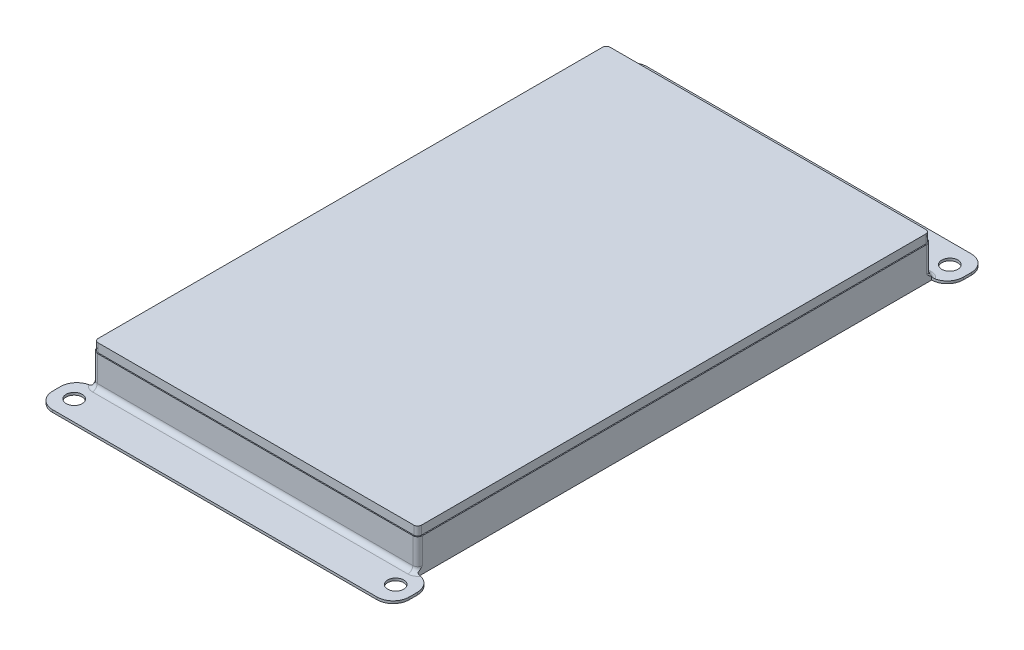
from build123d import *

# Parameters (mm, degrees)
SKETCH_1_R      = 1.65
EXTRUDE_1_DEPTH = 0.5
FILLET_1_R      = 3.3
SKETCH_2_W      = 66.770552446
SKETCH_2_H      = 105.5
EXTRUDE_2_DEPTH = 6.83
FILLET_2_R      = 1
EXTRUDE_3_DEPTH = 1.78
FILLET_3_R      = 1


with BuildPart() as part:
    # 草图1 → 凸台-拉伸1 (new body)
    with BuildSketch(Plane(origin=(0, 0, 0), x_dir=(1, 0, 0), z_dir=(0, 1, 0))):
        Polygon((66.385276223, -4.125), (69.6, -4.125), (69.6, 4.125), (-3.6, 4.125), (-3.6, -4.125), (-0.385276223, -4.125), (-0.385276223, -109.625), (-3.6, -109.625), (-3.6, -117.875), (69.6, -117.875), (69.6, -109.625), (66.385276223, -109.625), align=None)
        with Locations(Location((0, 0, 0), (0, 0, 270))):
            Circle(SKETCH_1_R, mode=Mode.SUBTRACT)
        with Locations(Location((66, 0, 0), (0, 0, 270))):
            Circle(SKETCH_1_R, mode=Mode.SUBTRACT)
        with Locations(Location((66, -113.75, 0), (0, 0, 90))):
            Circle(SKETCH_1_R, mode=Mode.SUBTRACT)
        with Locations(Location((0, -113.75, 0), (0, 0, 90))):
            Circle(SKETCH_1_R, mode=Mode.SUBTRACT)
    extrude(amount=EXTRUDE_1_DEPTH)

    # 圆角1
    # the kernel refuses this fillet: 3.3 mm, written as the material it takes off along each edge
    with BuildSketch(Plane(origin=(69.6, -8.247244982, 109.625), x_dir=(0, 0, 1), z_dir=(0, 1, 0)), Plane(origin=(-3.6, -8.247244982, 4.125), x_dir=(0, 0, -1), z_dir=(0, 1, 0))) as fillet_1_piece_1:
        with BuildLine():
            CenterArc((3.298897993, -3.3), FILLET_1_R, 90, 88.519238897)
            Line((0, -3.214723777), (-0.06597796, -3.213018252))
            ThreePointArc((-0.06597796, -3.213018252), (-0.066, -1.607361888), (-0.066, 0))
            Line((-0.066, 0), (0, 0.066))
            Line((0, 0.066), (3.298897993, 0.066))
            Line((3.298897993, 0.066), (3.298897993, 0))
        make_face()
    extrude(amount=16.994489963, mode=Mode.SUBTRACT)
    with BuildSketch(Plane(origin=(69.6, -8.25, 117.875), x_dir=(-1, 0, 0), z_dir=(0, 1, 0)), Plane(origin=(-3.6, -8.25, 117.875), x_dir=(0, 0, -1), z_dir=(0, 1, 0)), Plane(origin=(-3.6, -8.25, -4.125), x_dir=(1, 0, 0), z_dir=(0, 1, 0)), Plane(origin=(69.6, -8.25, -4.125), x_dir=(0, 0, 1), z_dir=(0, 1, 0))) as fillet_1_piece_2:
        with BuildLine():
            CenterArc((FILLET_1_R, -FILLET_1_R), FILLET_1_R, 90, 90)
            Line((0, -FILLET_1_R), (-FILLET_1_R * 0.02, -FILLET_1_R))
            Line((-FILLET_1_R * 0.02, -FILLET_1_R), (-FILLET_1_R * 0.02, FILLET_1_R * 0.02))
            Line((-FILLET_1_R * 0.02, FILLET_1_R * 0.02), (FILLET_1_R, FILLET_1_R * 0.02))
            Line((FILLET_1_R, FILLET_1_R * 0.02), (FILLET_1_R, 0))
        make_face()
    extrude(amount=17, mode=Mode.SUBTRACT)
    with BuildSketch(Plane(origin=(-3.6, -8.247244982, 109.625), x_dir=(1, 0, 0), z_dir=(0, 1, 0)), Plane(origin=(69.6, -8.247244982, 4.125), x_dir=(-1, 0, 0), z_dir=(0, 1, 0))) as fillet_1_piece_3:
        with BuildLine():
            CenterArc((3.3, -3.298897993), FILLET_1_R, 91.480761103, 88.519238897)
            Line((0, -3.298897993), (-0.066, -3.298897993))
            Line((-0.066, -3.298897993), (-0.066, 0))
            Line((-0.066, 0), (0, 0.066))
            ThreePointArc((0, 0.066), (1.607361888, 0.066), (3.213018252, 0.06597796))
            Line((3.213018252, 0.06597796), (3.214723777, 0))
        make_face()
    extrude(amount=16.994489963, mode=Mode.SUBTRACT)

    # 草图2 → 凸台-拉伸2 (add)
    with BuildSketch(Plane(origin=(0, 0, 0), x_dir=(1, 0, 0), z_dir=(0, 1, 0))):
        with Locations((33, -56.875)):
            Rectangle(SKETCH_2_W, SKETCH_2_H)
    extrude(amount=EXTRUDE_2_DEPTH)

    # 圆角2
    fillet_2_edges = [part.edges().sort_by_distance(p)[0] for p in [
        (-0.385276223, 3.665, 4.125),
        (-0.385276223, 3.665, 109.625),
        (66.385276223, 3.665, 109.625),
        (66.385276223, 3.665, 4.125),
    ]]
    fillet(fillet_2_edges, radius=FILLET_2_R)

    # 草图3 → 凸台-拉伸3 (add)
    with BuildSketch(Plane(origin=(0, 6.83, 0), x_dir=(1, 0, 0), z_dir=(0, 1, 0))):
        with BuildLine():
            Line((66.185276223, -108.625), (66.185276223, -5.125))
            ThreePointArc((66.185276223, -5.125), (65.950961648, -4.559314575), (65.385276223, -4.325))
            Line((65.385276223, -4.325), (0.614723777, -4.325))
            ThreePointArc((0.614723777, -4.325), (0.049038352, -4.559314575), (-0.185276223, -5.125))
            Line((-0.185276223, -5.125), (-0.185276223, -108.625))
            ThreePointArc((-0.185276223, -108.625), (0.049038352, -109.190685425), (0.614723777, -109.425))
            Line((0.614723777, -109.425), (65.385276223, -109.425))
            ThreePointArc((65.385276223, -109.425), (65.950961648, -109.190685425), (66.185276223, -108.625))
        make_face()
    extrude(amount=EXTRUDE_3_DEPTH)

    # 圆角3
    # the kernel refuses this fillet: 1 mm, written as the material it adds along each edge
    with BuildSketch(Plane(origin=(65.385276223, 0.5, 108.625), x_dir=(-0.8017442392976621, 0, -0.5976672776328089), z_dir=(-0.5976672776328089, 0, 0.8017442392976621))) as fillet_3_piece_1_section:
        with BuildLine():
            CenterArc((1 + FILLET_3_R, -FILLET_3_R), FILLET_3_R, 90, 90)
            Line((1 + FILLET_3_R, 0), (1, 0))
            Line((1, 0), (1, -FILLET_3_R))
        make_face()
    fillet_3_piece_1 = revolve(axis=Axis((65.385276223, 0.5, 108.625), (0, -1, 0)), revolution_arc=233.296989237, mode=Mode.PRIVATE)
    fillet_3_piece_1 = split(fillet_3_piece_1, bisect_by=Plane(origin=(66.385276223, 0.811675846, 109.374877518), z_dir=(-1, 0, 0)), keep=Keep.TOP, mode=Mode.PRIVATE)
    add(fillet_3_piece_1)
    with BuildSketch(Plane(origin=(65.385276223, 0.5, 108.625), x_dir=(-0.8017442392976621, 0, -0.5976672776328089), z_dir=(-0.5976672776328089, 0, 0.8017442392976621))) as fillet_3_piece_2_section:
        with BuildLine():
            CenterArc((1 + FILLET_3_R, -FILLET_3_R), FILLET_3_R, 90, 90)
            Line((1 + FILLET_3_R, 0), (1, 0))
            Line((1, 0), (1, -FILLET_3_R))
        make_face()
    fillet_3_piece_2 = revolve(axis=Axis((65.385276223, 0.5, 108.625), (0, -1, 0)), revolution_arc=233.296989237, mode=Mode.PRIVATE)
    fillet_3_piece_2 = fillet_3_piece_2 & Plane(origin=(66.3, 0.537437966, 112.923897993), x_dir=(0, 0, 1), z_dir=(0, -1, 0)) * Cylinder(3.3, 8, mode=Mode.PRIVATE)
    add(fillet_3_piece_2)
    with BuildSketch(Plane(origin=(0.614723777, 0.5, 108.625), x_dir=(0.8017442392976509, 0, -0.597667277632824), z_dir=(0.597667277632824, 0, 0.8017442392976509))) as fillet_3_piece_3_section:
        with BuildLine():
            CenterArc((1 + FILLET_3_R, FILLET_3_R), FILLET_3_R, 180, 90)
            Line((1, FILLET_3_R), (1, 0))
            Line((1, 0), (1 + FILLET_3_R, 0))
        make_face()
    fillet_3_piece_3 = revolve(axis=Axis((0.614723777, 0.5, 108.625), (0, 1, 0)), revolution_arc=233.296989237, mode=Mode.PRIVATE)
    fillet_3_piece_3 = split(fillet_3_piece_3, bisect_by=Plane(origin=(-0.385276223, 0.811675592, 109.374877608), z_dir=(1, 0, 0)), keep=Keep.TOP, mode=Mode.PRIVATE)
    add(fillet_3_piece_3)
    with BuildSketch(Plane(origin=(0.614723777, 0.5, 108.625), x_dir=(0.8017442392976509, 0, -0.597667277632824), z_dir=(0.597667277632824, 0, 0.8017442392976509))) as fillet_3_piece_4_section:
        with BuildLine():
            CenterArc((1 + FILLET_3_R, FILLET_3_R), FILLET_3_R, 180, 90)
            Line((1, FILLET_3_R), (1, 0))
            Line((1, 0), (1 + FILLET_3_R, 0))
        make_face()
    fillet_3_piece_4 = revolve(axis=Axis((0.614723777, 0.5, 108.625), (0, 1, 0)), revolution_arc=233.296989237, mode=Mode.PRIVATE)
    fillet_3_piece_4 = fillet_3_piece_4 & Plane(origin=(-0.3, 0.537437971, 112.923897993), x_dir=(1, 0, 0), z_dir=(0, -1, 0)) * Cylinder(3.3, 8, mode=Mode.PRIVATE)
    add(fillet_3_piece_4)
    with BuildSketch(Plane(origin=(0.614723777, 0.5, 5.125), x_dir=(0.8017442392976485, 0, 0.5976672776328273), z_dir=(0.5976672776328273, 0, -0.8017442392976485))) as fillet_3_piece_5_section:
        with BuildLine():
            CenterArc((1 + FILLET_3_R, -FILLET_3_R), FILLET_3_R, 90, 90)
            Line((1, -FILLET_3_R), (1, 0))
            Line((1, 0), (1 + FILLET_3_R, 0))
        make_face()
    fillet_3_piece_5 = revolve(axis=Axis((0.614723777, 0.5, 5.125), (0, -1, 0)), revolution_arc=233.296989237, mode=Mode.PRIVATE)
    fillet_3_piece_5 = split(fillet_3_piece_5, bisect_by=Plane(origin=(-0.385276223, 0.811675846, 4.375122482), z_dir=(1, 0, 0)), keep=Keep.TOP, mode=Mode.PRIVATE)
    add(fillet_3_piece_5)
    with BuildSketch(Plane(origin=(0.614723777, 0.5, 5.125), x_dir=(0.8017442392976485, 0, 0.5976672776328273), z_dir=(0.5976672776328273, 0, -0.8017442392976485))) as fillet_3_piece_6_section:
        with BuildLine():
            CenterArc((1 + FILLET_3_R, -FILLET_3_R), FILLET_3_R, 90, 90)
            Line((1, -FILLET_3_R), (1, 0))
            Line((1, 0), (1 + FILLET_3_R, 0))
        make_face()
    fillet_3_piece_6 = revolve(axis=Axis((0.614723777, 0.5, 5.125), (0, -1, 0)), revolution_arc=233.296989237, mode=Mode.PRIVATE)
    fillet_3_piece_6 = fillet_3_piece_6 & Plane(origin=(-0.3, 0.537437966, 0.826102007), x_dir=(0, 0, -1), z_dir=(0, -1, 0)) * Cylinder(3.3, 8, mode=Mode.PRIVATE)
    add(fillet_3_piece_6)
    with BuildSketch(Plane(origin=(65.385276223, 0.5, 5.125), x_dir=(-0.801744239297651, 0, 0.5976672776328237), z_dir=(-0.5976672776328237, 0, -0.801744239297651))) as fillet_3_piece_7_section:
        with BuildLine():
            CenterArc((1 + FILLET_3_R, FILLET_3_R), FILLET_3_R, 180, 90)
            Line((1 + FILLET_3_R, 0), (1, 0))
            Line((1, 0), (1, FILLET_3_R))
        make_face()
    fillet_3_piece_7 = revolve(axis=Axis((65.385276223, 0.5, 5.125), (0, 1, 0)), revolution_arc=233.296989237, mode=Mode.PRIVATE)
    fillet_3_piece_7 = split(fillet_3_piece_7, bisect_by=Plane(origin=(66.385276223, 0.811675555, 4.375122379), z_dir=(-1, 0, 0)), keep=Keep.TOP, mode=Mode.PRIVATE)
    add(fillet_3_piece_7)
    with BuildSketch(Plane(origin=(65.385276223, 0.5, 5.125), x_dir=(-0.801744239297651, 0, 0.5976672776328237), z_dir=(-0.5976672776328237, 0, -0.801744239297651))) as fillet_3_piece_8_section:
        with BuildLine():
            CenterArc((1 + FILLET_3_R, FILLET_3_R), FILLET_3_R, 180, 90)
            Line((1 + FILLET_3_R, 0), (1, 0))
            Line((1, 0), (1, FILLET_3_R))
        make_face()
    fillet_3_piece_8 = revolve(axis=Axis((65.385276223, 0.5, 5.125), (0, 1, 0)), revolution_arc=233.296989237, mode=Mode.PRIVATE)
    fillet_3_piece_8 = fillet_3_piece_8 & Plane(origin=(66.3, 0.537437971, 0.826102007), x_dir=(-1, 0, 0), z_dir=(0, -1, 0)) * Cylinder(3.3, 8, mode=Mode.PRIVATE)
    add(fillet_3_piece_8)
    with BuildSketch(Plane(origin=(0.614723777, 0.5, 109.625), x_dir=(0, 0, 1), z_dir=(1, 0, 0)), Plane(origin=(65.385276223, 0.5, 4.125), x_dir=(0, 0, -1), z_dir=(-1, 0, 0))) as fillet_3_piece_9:
        with BuildLine():
            CenterArc((FILLET_3_R, -FILLET_3_R), FILLET_3_R, 90, 90)
            Line((0, -FILLET_3_R), (0, 0))
            Line((0, 0), (FILLET_3_R, 0))
        make_face()
    extrude(amount=64.770552447)


solid = part.part
